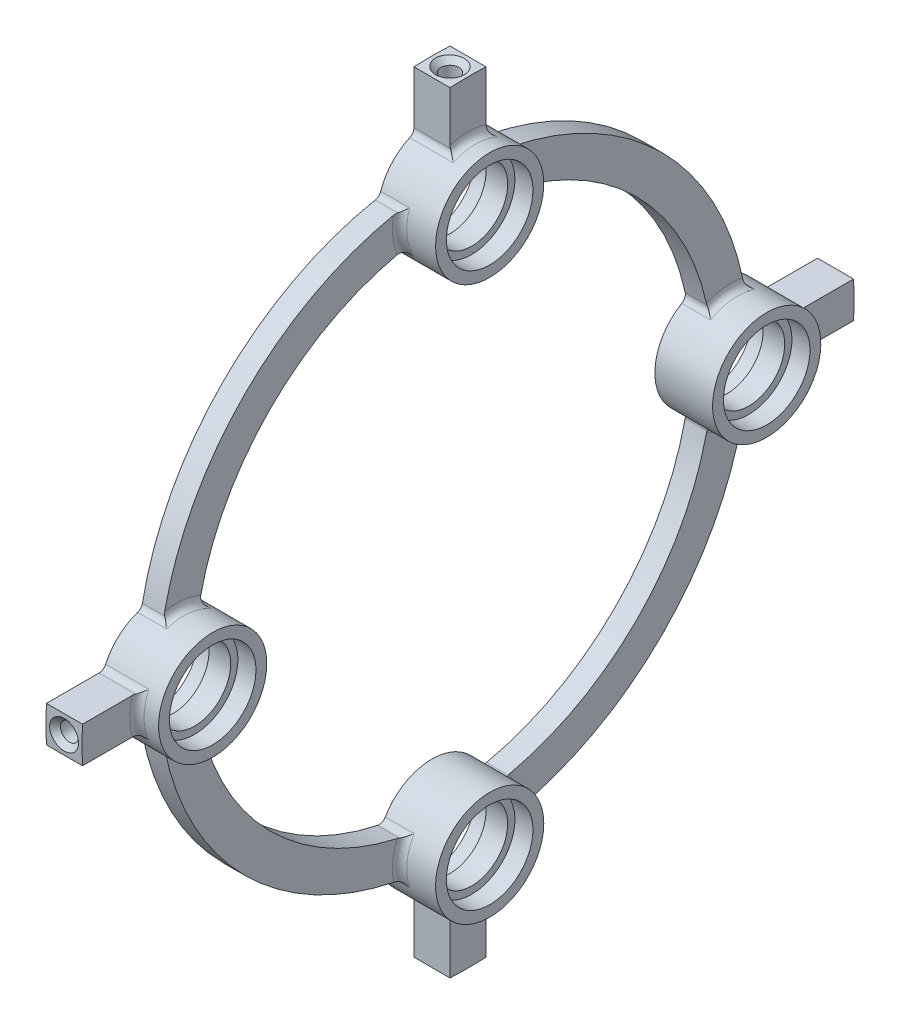
from build123d import *

# Parameters (mm, degrees)
SKETCH_1_R                       = 40.9
SKETCH_1_R_2                     = 35.9
EXTRUDE_1_DEPTH                  = 3
SKETCH_2_R                       = 7.5
EXTRUDE_2_DEPTH                  = 8
SKETCH_4_R                       = 5
CUT_EXTRUDE_1_DEPTH              = 62.996935408
SKETCH_5_R                       = 6
CUT_EXTRUDE_2_DEPTH              = 2.5
CUT_EXTRUDE_START                = -2.5
SKETCH_6_R                       = 6
CUT_EXTRUDE_3_DEPTH              = 2.5
EXTRUDE_3_DEPTH                  = 5
FILLET_1_R                       = 1
PATTERN_CIRCULAR_1_COUNT         = 4
FILLET_1_OF_PATTERN_CIRCULAR_1_R = 1


with BuildPart() as part:
    # Эскиз1 → Бобышка-Вытянуть1 (new body)
    with BuildSketch(Plane(origin=(0, 0, 0), x_dir=(0, 0, -1), z_dir=(1, 0, 0))):
        Circle(SKETCH_1_R)
        Circle(SKETCH_1_R_2, mode=Mode.SUBTRACT)
    extrude(amount=EXTRUDE_1_DEPTH)

    # Эскиз2 → Бобышка-Вытянуть2 (add)
    with BuildSketch(Plane.ZY):
        with Locations((0, 38.4)):
            Circle(SKETCH_2_R)
    extrude_2 = extrude(amount=-EXTRUDE_2_DEPTH)

    # Эскиз4 → Вырез-Вытянуть1 (cut, through all)
    with BuildSketch(Plane.ZY):
        with Locations((0, 38.4)):
            Circle(SKETCH_4_R)
    cut_extrude_1 = extrude(amount=-CUT_EXTRUDE_1_DEPTH, mode=Mode.SUBTRACT)

    # Эскиз5 → Вырез-Вытянуть2 (cut)
    with BuildSketch(Plane.ZY):
        with Locations((0, 38.4)):
            Circle(SKETCH_5_R)
    cut_extrude_2 = extrude(amount=-CUT_EXTRUDE_2_DEPTH, mode=Mode.SUBTRACT)

    # Эскиз6 → Вырез-Вытянуть3 (cut)
    with BuildSketch(Plane(origin=(8, 0, 0), x_dir=(0, 0, -1), z_dir=(1, 0, 0)).offset(CUT_EXTRUDE_START)):
        with Locations((0, 38.4)):
            Circle(SKETCH_6_R)
    cut_extrude_3 = extrude(amount=CUT_EXTRUDE_3_DEPTH, mode=Mode.SUBTRACT)

    # Эскиз7 → Бобышка-Вытянуть3 (add)
    with BuildSketch(Plane.ZY):
        with BuildLine():
            Line((-2.5, 53.441556864), (-2.5, 45.471067812))
            ThreePointArc((-2.5, 45.471067812), (0, 45.9), (2.5, 45.471067812))
            Line((2.5, 45.471067812), (2.5, 53.441556864))
            ThreePointArc((2.5, 53.441556864), (0, 53.5), (-2.5, 53.441556864))
        make_face()
    extrude_3 = extrude(amount=-EXTRUDE_3_DEPTH)

    # Скругление1
    fillet_1_edges = [part.edges().sort_by_distance(p)[0] for p in [
        (3, 36.786713686, 7.324432215),
        (3, 37.709096353, -7.468109008),
        (1.5, 35.248958333, -6.805948605),
        (1.5, 35.248958333, 6.805948605),
        (1.5, 40.248958333, 7.268517943),
        (1.5, 40.248958333, -7.268517943),
        (5, 45.9, 0),
        (2.5, 45.471067812, 2.5),
        (2.5, 45.471067812, -2.5),
    ]]
    fillet(fillet_1_edges, radius=FILLET_1_R)

    # Эскиз8 → Отверстие обработанное метчиком M31 (revolve, cut)
    with BuildSketch(Plane(origin=(2.5, 53.5, 0), x_dir=(0, 0, 1), z_dir=(1, 0, 0))):
        Polygon((0, 0), (0, 7.751075774), (1.25, 7), (1.25, 0.75), (2, 0), align=None)
    hole_wizard_m31 = revolve(axis=Axis((2.5, 59.85, 0), (0, -1, 0)), mode=Mode.SUBTRACT)

    # Круговой массив1: Бобышка-Вытянуть2, Вырез-Вытянуть1, Вырез-Вытянуть2, Вырез-Вытянуть3, Бобышка-Вытянуть3, Отверстие обработанное метчиком M31 ×4 about axis
    pattern_circular_1_axis = Axis((3, 0, 0), (-1, 0, 0))
    add([extrude_2.rotate(pattern_circular_1_axis, i * 360 / PATTERN_CIRCULAR_1_COUNT) for i in range(1, PATTERN_CIRCULAR_1_COUNT)])
    add([cut_extrude_1.rotate(pattern_circular_1_axis, i * 360 / PATTERN_CIRCULAR_1_COUNT) for i in range(1, PATTERN_CIRCULAR_1_COUNT)], mode=Mode.SUBTRACT)
    add([cut_extrude_2.rotate(pattern_circular_1_axis, i * 360 / PATTERN_CIRCULAR_1_COUNT) for i in range(1, PATTERN_CIRCULAR_1_COUNT)], mode=Mode.SUBTRACT)
    add([cut_extrude_3.rotate(pattern_circular_1_axis, i * 360 / PATTERN_CIRCULAR_1_COUNT) for i in range(1, PATTERN_CIRCULAR_1_COUNT)], mode=Mode.SUBTRACT)
    add([extrude_3.rotate(pattern_circular_1_axis, i * 360 / PATTERN_CIRCULAR_1_COUNT) for i in range(1, PATTERN_CIRCULAR_1_COUNT)])
    add([hole_wizard_m31.rotate(pattern_circular_1_axis, i * 360 / PATTERN_CIRCULAR_1_COUNT) for i in range(1, PATTERN_CIRCULAR_1_COUNT)], mode=Mode.SUBTRACT)

    # Скругление1 of Круговой массив1
    fillet_1_of_pattern_circular_1_edges = [part.edges().sort_by_distance(p)[0] for p in [
        (3, 7.324432215, -36.786713686),
        (3, -7.468109008, -37.709096353),
        (1.5, -6.805948605, -35.248958333),
        (1.5, 6.805948605, -35.248958333),
        (1.5, 7.268517943, -40.248958333),
        (1.5, -7.268517943, -40.248958333),
        (5, 0, -45.9),
        (2.5, 2.5, -45.471067812),
        (2.5, -2.5, -45.471067812),
        (3, -36.786713686, -7.324432215),
        (3, -37.709096353, 7.468109008),
        (1.5, -35.248958333, 6.805948605),
        (1.5, -35.248958333, -6.805948605),
        (1.5, -40.248958333, -7.268517943),
        (1.5, -40.248958333, 7.268517943),
        (5, -45.9, 0),
        (2.5, -45.471067812, -2.5),
        (2.5, -45.471067812, 2.5),
        (3, -7.324432215, 36.786713686),
        (3, 7.468109008, 37.709096353),
        (1.5, 6.805948605, 35.248958333),
        (1.5, -6.805948605, 35.248958333),
        (1.5, -7.268517943, 40.248958333),
        (1.5, 7.268517943, 40.248958333),
        (5, 0, 45.9),
        (2.5, -2.5, 45.471067812),
        (2.5, 2.5, 45.471067812),
    ]]
    fillet(fillet_1_of_pattern_circular_1_edges, radius=FILLET_1_OF_PATTERN_CIRCULAR_1_R)


solid = part.part
